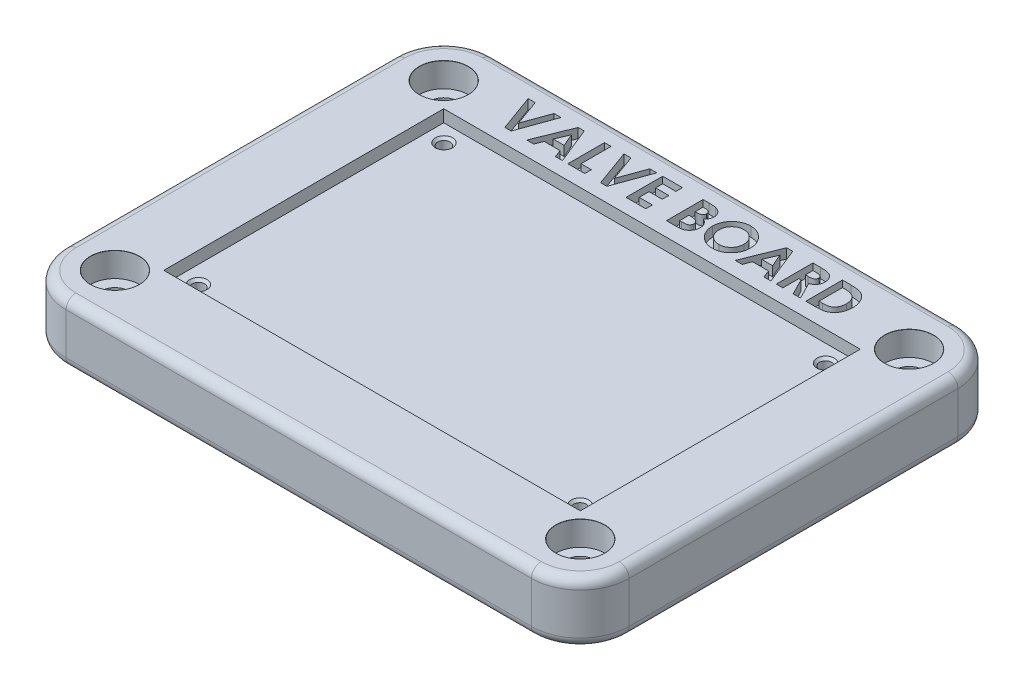
from build123d import *

# Parameters (mm, degrees)
SKETCH1_W           = 85.32
SKETCH1_H           = 57.35
SKETCH1_R           = 1.275
BOSS_EXTRUDE1_DEPTH = 10
SKETCH1_3_W         = 115.32
SKETCH1_3_H         = 87.35
SKETCH1_3_W_2       = 85.32
SKETCH1_3_H_2       = 57.35
BOSS_EXTRUDE2_DEPTH = 12.5
FILLET1_R           = 10
FILLET2_R           = 2
CUT_EXTRUDE1_DEPTH  = 2
CHAMFER1_SIZE       = 0.5


# Read off the part's stored shape, not the designer's step: CBORE for M5 SHCS1
with BuildPart() as part:
    # Sketch1 → Boss-Extrude1 (new body)
    with BuildSketch(Plane(origin=(0, 0, 0), x_dir=(1, 0, 0), z_dir=(0, 1, 0))):
        Rectangle(SKETCH1_W, SKETCH1_H)
        with Locations(Location((39.085, 25.15, 0), (0, 0, 270))):
            Circle(SKETCH1_R, mode=Mode.SUBTRACT)
        with Locations(Location((-39.085, 25.15, 0), (0, 0, 270))):
            Circle(SKETCH1_R, mode=Mode.SUBTRACT)
        with Locations(Location((-39.085, -25.15, 0), (0, 0, 270))):
            Circle(SKETCH1_R, mode=Mode.SUBTRACT)
        with Locations(Location((39.085, -25.15, 0), (0, 0, 270))):
            Circle(SKETCH1_R, mode=Mode.SUBTRACT)
    extrude(amount=BOSS_EXTRUDE1_DEPTH)

    # Sketch1<3> → Boss-Extrude2 (add)
    with BuildSketch(Plane(origin=(0, 0, 0), x_dir=(1, 0, 0), z_dir=(0, 1, 0))):
        Rectangle(SKETCH1_3_W, SKETCH1_3_H)
        Rectangle(SKETCH1_3_W_2, SKETCH1_3_H_2, mode=Mode.SUBTRACT)
    extrude(amount=BOSS_EXTRUDE2_DEPTH)

    # CBORE for M5 SHCS1 outline → CBORE for M5 SHCS1 (revolve, cut)
    with BuildSketch(Plane(origin=(47.66, 0, 33.675), x_dir=(1, 0, 0), z_dir=(0, 0, 1))):
        Polygon((0, 0), (2.75, 0), (2.75, 7.5), (5, 7.5), (5, 12.475), (5.025, 12.5), (0, 12.5), align=None)
    revolve(axis=Axis((47.66, 0, 33.675), (0, 1, 0)), mode=Mode.SUBTRACT)

    # CBORE for M5 SHCS1 2 outline → CBORE for M5 SHCS1 2 (revolve, cut)
    with BuildSketch(Plane(origin=(-47.66, 0, -33.675), x_dir=(1, 0, 0), z_dir=(0, 0, 1))):
        Polygon((0, 12.5), (0, 0), (2.75, 0), (2.75, 7.5), (5, 7.5), (5, 12.475), (5.025, 12.5), align=None)
    revolve(axis=Axis((-47.66, 0, -33.675), (0, 1, 0)), mode=Mode.SUBTRACT)

    # CBORE for M5 SHCS1 3 outline → CBORE for M5 SHCS1 3 (revolve, cut)
    with BuildSketch(Plane(origin=(-47.66, 0, 33.675), x_dir=(1, 0, 0), z_dir=(0, 0, 1))):
        Polygon((0, 12.5), (0, 0), (2.75, 0), (2.75, 7.5), (5, 7.5), (5, 12.475), (5.025, 12.5), align=None)
    revolve(axis=Axis((-47.66, 0, 33.675), (0, 1, 0)), mode=Mode.SUBTRACT)

    # CBORE for M5 SHCS1 4 outline → CBORE for M5 SHCS1 4 (revolve, cut)
    with BuildSketch(Plane(origin=(47.66, 0, -33.675), x_dir=(1, 0, 0), z_dir=(0, 0, 1))):
        Polygon((0, 12.5), (0, 0), (2.75, 0), (2.75, 7.5), (5, 7.5), (5, 12.475), (5.025, 12.5), align=None)
    revolve(axis=Axis((47.66, 0, -33.675), (0, 1, 0)), mode=Mode.SUBTRACT)

    # Fillet1
    fillet1_edges = [part.edges().sort_by_distance(p)[0] for p in [
        (-57.66, 6.25, 43.675),
        (57.66, 6.25, 43.675),
        (57.66, 6.25, -43.675),
        (-57.66, 6.25, -43.675),
    ]]
    fillet(fillet1_edges, radius=FILLET1_R)

    # Fillet2
    fillet2_edges = [part.edges().sort_by_distance(p)[0] for p in [
        (54.731067812, 0, 40.746067812),
        (0, 12.5, 43.675),
        (0, 12.5, -43.675),
        (-57.66, 12.5, 0),
        (-54.731067812, 12.5, 40.746067812),
        (-54.731067812, 12.5, -40.746067812),
        (54.731067812, 12.5, -40.746067812),
        (54.731067812, 12.5, 40.746067812),
        (57.66, 0, 0),
        (57.66, 12.5, 0),
        (0, 0, 43.675),
        (-57.66, 0, 0),
        (0, 0, -43.675),
        (-54.731067812, 0, 40.746067812),
        (-54.731067812, 0, -40.746067812),
        (54.731067812, 0, -40.746067812),
    ]]
    fillet(fillet2_edges, radius=FILLET2_R)

    # Sketch4 → Cut-Extrude1 (cut)
    # profile 1 of 10: a face of its own
    with BuildSketch(Plane(origin=(0, 12.5, 0), x_dir=(1, 0, 0), z_dir=(0, 1, 0))):
        Polygon((-35.80574543, 39.121172), (-34.367944949, 39.121172), (-32.440360814, 33.793647962), (-30.508269468, 39.121172), (-29.074976199, 39.121172), (-31.79432716, 31.621172), (-33.09090168, 31.621172), align=None)
    # profile 2 of 10: a face of its own
    with BuildSketch(Plane(origin=(0, 12.5, 0), x_dir=(1, 0, 0), z_dir=(0, 1, 0))):
        Polygon((-25.56385841, 39.121172), (-24.315360814, 39.121172), (-21.28651466, 31.621172), (-22.724315141, 31.621172), (-23.307247833, 33.159633538), (-26.574976199, 33.159633538), (-27.157908891, 31.621172), (-28.594206968, 31.621172), align=None)
        Polygon((-24.940360814, 37.10945325), (-26.064158891, 34.505787385), (-23.816562737, 34.505787385), align=None, mode=Mode.SUBTRACT)
    # profile 3 of 10: a face of its own
    with BuildSketch(Plane(origin=(0, 12.5, 0), x_dir=(1, 0, 0), z_dir=(0, 1, 0))):
        Polygon((-20.18074543, 39.121172), (-18.834591583, 39.121172), (-18.834591583, 32.967325846), (-16.719206968, 32.967325846), (-16.719206968, 31.621172), (-20.18074543, 31.621172), align=None)
    # profile 4 of 10: a face of its own
    with BuildSketch(Plane(origin=(0, 12.5, 0), x_dir=(1, 0, 0), z_dir=(0, 1, 0))):
        Polygon((-16.190360814, 39.121172), (-14.752560333, 39.121172), (-12.824976199, 33.793647962), (-10.892884853, 39.121172), (-9.459591583, 39.121172), (-12.178942545, 31.621172), (-13.475517064, 31.621172), align=None)
    # profile 5 of 10: a face of its own
    with BuildSketch(Plane(origin=(0, 12.5, 0), x_dir=(1, 0, 0), z_dir=(0, 1, 0))):
        Polygon((-8.257668506, 39.121172), (-4.219206968, 39.121172), (-4.219206968, 37.775018154), (-6.91151466, 37.775018154), (-6.91151466, 36.332710462), (-4.219206968, 36.332710462), (-4.219206968, 34.986556615), (-6.91151466, 34.986556615), (-6.91151466, 32.967325846), (-4.219206968, 32.967325846), (-4.219206968, 31.621172), (-8.257668506, 31.621172), align=None)
    # profile 6 of 10: a face of its own
    with BuildSketch(Plane(origin=(0, 12.5, 0), x_dir=(1, 0, 0), z_dir=(0, 1, 0))):
        with BuildLine():
            Line((0.011562263, 31.621172), (0.011562263, 39.121172))
            Line((0.011562263, 39.121172), (1.21348534, 39.121172))
            add(Edge.make_bspline(
                [(1.21348534, 39.121172), (1.29762747, 39.121181603), (1.460440898, 39.121200184), (1.695338184, 39.112951362), (1.913185578, 39.102280588), (2.113289807, 39.090342472), (2.295991462, 39.069770714), (2.461012715, 39.048090328), (2.608683278, 39.021945119), (2.699979964, 38.998492056), (2.742932455, 38.987458058)],
                knots=[0, 0, 0, 0, 1.311965854, 2.538629056, 3.664479157, 4.713267157, 5.663616078, 6.530575999, 7.308677837, 8, 8, 8, 8], degree=3))
            add(Edge.make_bspline(
                [(2.742932455, 38.987458058), (2.799333437, 38.971894406), (2.910010271, 38.941353526), (3.068534816, 38.879674899), (3.21891746, 38.811114732), (3.36097459, 38.732900404), (3.493833918, 38.644087649), (3.616990534, 38.543971622), (3.733100621, 38.436570977), (3.838041375, 38.318892488), (3.932890527, 38.194543365), (4.015297434, 38.063556192), (4.086898474, 37.927933848), (4.144198061, 37.785969615), (4.187372223, 37.638317278), (4.218949625, 37.485607336), (4.239416057, 37.327356575), (4.241349867, 37.21969341), (4.242331494, 37.165042192)],
                knots=[0, 0, 0, 0, 1.099996261, 2.158545794, 3.195537121, 4.207578794, 5.205712374, 6.197378256, 7.190519799, 8.17788031, 9.159561366, 10.129234751, 11.085776129, 12.040971148, 13.00380137, 13.975669004, 14.972423361, 16, 16, 16, 16], degree=3))
            add(Edge.make_bspline(
                [(4.242331494, 37.165042192), (4.239764831, 37.094829723), (4.234712672, 36.956625104), (4.202439134, 36.753627523), (4.141921223, 36.561765632), (4.062735008, 36.377503487), (3.955066513, 36.201528389), (3.818348347, 36.033924009), (3.654794897, 35.869529556), (3.529340372, 35.77098617), (3.464086301, 35.719729692)],
                knots=[0, 0, 0, 0, 0.986156485, 1.941127874, 2.875419072, 3.804401753, 4.751181392, 5.761612777, 6.835722519, 8, 8, 8, 8], degree=3))
            add(Edge.make_bspline(
                [(3.464086301, 35.719729692), (3.51696507, 35.69273554), (3.620645705, 35.639807474), (3.767841747, 35.552809535), (3.904129214, 35.460276194), (4.030119179, 35.364069257), (4.143168856, 35.260110374), (4.247946258, 35.154389799), (4.33928221, 35.040850182), (4.420957572, 34.923538291), (4.491948468, 34.800755436), (4.553773711, 34.672708971), (4.605995276, 34.53896146), (4.650217848, 34.40019357), (4.683199054, 34.255928005), (4.704703502, 34.106113168), (4.721168651, 33.951260006), (4.722449485, 33.845777899), (4.723100724, 33.792145558)],
                knots=[0, 0, 0, 0, 1.164658916, 2.283573913, 3.35186032, 4.395461096, 5.390182219, 6.362969632, 7.312859996, 8.245001507, 9.165155236, 10.092416118, 11.032087915, 11.979892451, 12.947605196, 13.931445124, 14.948243989, 16, 16, 16, 16], degree=3))
            add(Edge.make_bspline(
                [(4.723100724, 33.792145558), (4.718874615, 33.689710853), (4.710534405, 33.487556374), (4.649554861, 33.190747171), (4.543835706, 32.909345126), (4.401876682, 32.644468651), (4.226955852, 32.403785485), (4.025847058, 32.192949122), (3.800575006, 32.014480821), (3.592734309, 31.894028562), (3.412968475, 31.813193833), (3.264071793, 31.763216706), (3.104159913, 31.716917971), (2.930303632, 31.684406044), (2.745654729, 31.654647553), (2.548412865, 31.636274044), (2.338946681, 31.623822769), (2.195076251, 31.622073454), (2.120937263, 31.621172)],
                knots=[0, 0, 0, 0, 1.284142165, 2.534249414, 3.780121997, 5.041676246, 6.291546858, 7.49970053, 8.684500223, 9.883330709, 10.50184324, 11.153274765, 11.851151195, 12.587658647, 13.369265475, 14.195992086, 15.070362669, 16, 16, 16, 16], degree=3))
            Line((2.120937263, 31.621172), (0.011562263, 31.621172))
        make_face()
        with BuildLine():
            Line((1.357716109, 37.775018154), (1.357716109, 36.140402769))
            Line((1.357716109, 36.140402769), (1.715288224, 36.140402769))
            add(Edge.make_bspline(
                [(1.715288224, 36.140402769), (1.763885487, 36.140826556), (1.857699563, 36.14164465), (1.993204044, 36.15218142), (2.119201328, 36.170157803), (2.235213534, 36.19523938), (2.342321359, 36.227089326), (2.439840567, 36.265411671), (2.527342384, 36.312169096), (2.628999256, 36.381816344), (2.736457902, 36.484305389), (2.831052538, 36.632372048), (2.886768148, 36.802648143), (2.892973364, 36.92274003), (2.896177647, 36.984753731)],
                knots=[0, 0, 0, 0, 1.065314748, 2.056525647, 2.977365736, 3.853934255, 4.656397591, 5.425096493, 6.14721249, 6.826394842, 8.123232004, 9.372140726, 10.643011755, 12, 12, 12, 12], degree=3))
            add(Edge.make_bspline(
                [(2.896177647, 36.984753731), (2.893613634, 37.042839865), (2.888656218, 37.155147071), (2.832557762, 37.312836391), (2.745425771, 37.452581401), (2.642554208, 37.548225433), (2.545680642, 37.613547486), (2.46273155, 37.656559277), (2.371688693, 37.695062992), (2.270789579, 37.724503871), (2.160610397, 37.74659527), (2.041686348, 37.762818757), (1.913812248, 37.773861153), (1.825489336, 37.774624214), (1.77989159, 37.775018154)],
                knots=[0, 0, 0, 0, 1.347982417, 2.606269829, 3.849316587, 5.153353503, 5.842674298, 6.568177932, 7.326619318, 8.142485038, 9.012069166, 9.942760135, 10.937925643, 12, 12, 12, 12], degree=3))
            Line((1.77989159, 37.775018154), (1.357716109, 37.775018154))
        make_face(mode=Mode.SUBTRACT)
        with BuildLine():
            Line((1.357716109, 34.890402769), (1.357716109, 32.967325846))
            Line((1.357716109, 32.967325846), (1.745336301, 32.967325846))
            add(Edge.make_bspline(
                [(1.745336301, 32.967325846), (1.821969307, 32.967763648), (1.969305823, 32.968605376), (2.18036512, 32.978775452), (2.372270787, 32.997105223), (2.544514345, 33.019988465), (2.697359617, 33.050991679), (2.830289951, 33.090408292), (2.945128312, 33.133773433), (3.041186126, 33.18733453), (3.119659857, 33.249666364), (3.190474172, 33.313370996), (3.248211751, 33.386860308), (3.293894802, 33.466979607), (3.333433401, 33.551738672), (3.357280292, 33.644447314), (3.375436478, 33.742357871), (3.376435662, 33.810080486), (3.376946878, 33.844729692)],
                knots=[0, 0, 0, 0, 1.753078804, 3.370512758, 4.83203934, 6.162291463, 7.344201807, 8.395507345, 9.331626367, 10.147333109, 10.898971645, 11.62040215, 12.321813352, 13.025280112, 13.727906689, 14.453419512, 15.208716525, 16, 16, 16, 16], degree=3))
            add(Edge.make_bspline(
                [(3.376946878, 33.844729692), (3.375819499, 33.884351604), (3.373623668, 33.96152443), (3.355690289, 34.074320752), (3.323099482, 34.179623602), (3.282049771, 34.280125716), (3.224926916, 34.37222877), (3.157038355, 34.459120099), (3.075011642, 34.537857297), (2.982767819, 34.613202681), (2.875174532, 34.679171648), (2.752181301, 34.736411411), (2.61311996, 34.784215954), (2.457559752, 34.822277962), (2.286182641, 34.854580662), (2.097737763, 34.87386894), (1.893794551, 34.88821448), (1.752377009, 34.889656765), (1.679230532, 34.890402769)],
                knots=[0, 0, 0, 0, 0.845221588, 1.646264278, 2.427170338, 3.19324141, 3.95557735, 4.731569926, 5.540061037, 6.376114724, 7.268642756, 8.224665384, 9.265483498, 10.400594375, 11.639216012, 12.983232105, 14.439614077, 16, 16, 16, 16], degree=3))
            Line((1.679230532, 34.890402769), (1.357716109, 34.890402769))
        make_face(mode=Mode.SUBTRACT)
    # profile 7 of 10: a face of its own
    with BuildSketch(Plane(origin=(0, 12.5, 0), x_dir=(1, 0, 0), z_dir=(0, 1, 0))):
        with BuildLine():
            add(Edge.make_bspline(
                [(9.593893994, 39.313479692), (9.724290685, 39.310103488), (9.981723289, 39.303438097), (10.360313751, 39.24787686), (10.725155663, 39.15734779), (11.076084043, 39.031505834), (11.412220208, 38.866942554), (11.734749822, 38.668323425), (12.0425176, 38.431899631), (12.332369783, 38.163186549), (12.600245477, 37.870972806), (12.832359922, 37.55635276), (13.030298605, 37.227478533), (13.194350715, 36.883468896), (13.319306932, 36.521941418), (13.406993879, 36.144739413), (13.463328397, 35.75197019), (13.469807733, 35.484547885), (13.473100724, 35.348635942)],
                knots=[0, 0, 0, 0, 1.014329547, 2.002516266, 2.970391464, 3.935626869, 4.897733899, 5.877609409, 6.878433252, 7.912639331, 8.949961323, 9.958554974, 10.949718813, 11.932905612, 12.9188844, 13.919928257, 14.942845884, 16, 16, 16, 16], degree=3))
            add(Edge.make_bspline(
                [(13.473100724, 35.348635942), (13.469593832, 35.214255413), (13.462683387, 34.94945427), (13.4092937, 34.56030457), (13.320130095, 34.187143184), (13.197293233, 33.829125453), (13.036216408, 33.487985491), (12.842137745, 33.161545168), (12.609935876, 32.852833928), (12.348080116, 32.562017436), (12.05979965, 32.298039068), (11.754464871, 32.065408586), (11.433485629, 31.868286295), (11.097331734, 31.706762486), (10.74528232, 31.581409806), (10.378206992, 31.492964382), (9.996128465, 31.439214312), (9.736296538, 31.432349006), (9.60441082, 31.428864308)],
                knots=[0, 0, 0, 0, 1.051557043, 2.072126891, 3.067553643, 4.050577992, 5.02905126, 6.015227836, 7.017913613, 8.04756643, 9.074058332, 10.072836633, 11.047628519, 12.017157415, 12.98668631, 13.966869689, 14.968021931, 16, 16, 16, 16], degree=3))
            add(Edge.make_bspline(
                [(9.60441082, 31.428864308), (9.466474173, 31.431990254), (9.195447516, 31.43813231), (8.79879879, 31.496540466), (8.418775038, 31.584523552), (8.058568676, 31.715833588), (7.714511312, 31.879982174), (7.389130837, 32.082141), (7.082536599, 32.321975981), (6.796487272, 32.593344855), (6.53732589, 32.890281924), (6.308565135, 33.203969605), (6.115600364, 33.532011601), (5.958424516, 33.874561441), (5.834513392, 34.229490262), (5.747108172, 34.598959683), (5.695475823, 34.982083583), (5.688283737, 35.242308994), (5.684639186, 35.374176808)],
                knots=[0, 0, 0, 0, 1.067978421, 2.098431617, 3.099715153, 4.085208694, 5.062210972, 6.048429807, 7.046490867, 8.072918869, 9.098532598, 10.095778865, 11.076610158, 12.041847152, 13.011192615, 13.984257998, 14.978533688, 16, 16, 16, 16], degree=3))
            add(Edge.make_bspline(
                [(5.684639186, 35.374176808), (5.685783056, 35.462890569), (5.688056312, 35.639194773), (5.715440074, 35.900468604), (5.754864819, 36.15664272), (5.813172145, 36.406695752), (5.884000644, 36.652391708), (5.97576897, 36.891443588), (6.08022616, 37.126405125), (6.202274551, 37.354501128), (6.337980561, 37.573632923), (6.4860479, 37.782766828), (6.646848881, 37.979374107), (6.819865512, 38.164746784), (7.00569403, 38.337666389), (7.201890054, 38.500580841), (7.412258645, 38.649162553), (7.632195493, 38.787040186), (7.860460646, 38.911720538), (8.096124858, 39.017844725), (8.334332979, 39.11052117), (8.578267149, 39.183665518), (8.82531318, 39.243240825), (9.078110258, 39.282638997), (9.334374505, 39.310022001), (9.5071822, 39.312324393), (9.593893994, 39.313479692)],
                knots=[0, 0, 0, 0, 1.034744296, 2.056386356, 3.06226378, 4.057406941, 5.050368692, 6.043467995, 7.042652155, 8.049140477, 9.059438543, 10.048523776, 11.036952808, 12.020949711, 13.004946614, 13.997082645, 14.994316842, 16.007702937, 17.024872941, 18.026463647, 19.021641123, 20.005082605, 20.995858141, 21.984425357, 22.988620895, 24, 24, 24, 24], degree=3))
        make_face()
        with BuildLine():
            add(Edge.make_bspline(
                [(9.57286034, 37.967325846), (9.485103383, 37.96497113), (9.311906269, 37.960323862), (9.057857644, 37.92491797), (8.813961992, 37.868370735), (8.581571323, 37.786462757), (8.359678437, 37.682214689), (8.147889985, 37.555990786), (7.9491388, 37.403452244), (7.760774726, 37.232788176), (7.590618782, 37.042629183), (7.440280637, 36.838841482), (7.314471824, 36.621765396), (7.209106156, 36.393417509), (7.129789159, 36.15123011), (7.073294041, 35.89710028), (7.037591235, 35.630590139), (7.033090852, 35.448910523), (7.030793032, 35.356147962)],
                knots=[0, 0, 0, 0, 1.033739768, 2.040188636, 3.016340934, 3.979330865, 4.937572243, 5.900995986, 6.878200029, 7.884839167, 8.891893314, 9.879764717, 10.863503415, 11.843163062, 12.837761627, 13.859916423, 14.907309254, 16, 16, 16, 16], degree=3))
            add(Edge.make_bspline(
                [(7.030793032, 35.356147962), (7.033839591, 35.253346176), (7.03981034, 35.051871711), (7.081821263, 34.757966189), (7.153697771, 34.480401594), (7.25748605, 34.220535452), (7.386210745, 33.975482145), (7.546066386, 33.748245149), (7.734464069, 33.537463876), (7.879604118, 33.414400989), (7.953268994, 33.351941231)],
                knots=[0, 0, 0, 0, 1.078454662, 2.113592447, 3.107694534, 4.079536787, 5.043276885, 6.005368276, 6.987637804, 8, 8, 8, 8], degree=3))
            add(Edge.make_bspline(
                [(7.953268994, 33.351941231), (8.01361459, 33.30579836), (8.132946187, 33.214552227), (8.323425397, 33.097601588), (8.519581476, 32.997363223), (8.722894667, 32.916371811), (8.932935584, 32.852665327), (9.149675424, 32.808052724), (9.372807085, 32.780054458), (9.523699171, 32.776708134), (9.599903609, 32.775018154)],
                knots=[0, 0, 0, 0, 1.023928204, 2.024787132, 3.009472467, 3.9914905, 4.972207045, 5.96565515, 6.972602802, 8, 8, 8, 8], degree=3))
            add(Edge.make_bspline(
                [(9.599903609, 32.775018154), (9.686151582, 32.777392835), (9.855847182, 32.782065096), (10.105166555, 32.817035123), (10.344022086, 32.876217033), (10.573896612, 32.957406486), (10.794127276, 33.062963479), (11.003637752, 33.193102451), (11.202795368, 33.346225463), (11.390919468, 33.519130724), (11.562873788, 33.710038812), (11.712898209, 33.914913495), (11.842707113, 34.129240771), (11.945881701, 34.356054118), (12.028332333, 34.593212524), (12.084147503, 34.841766312), (12.120151916, 35.100690849), (12.124653567, 35.276898147), (12.126946878, 35.366664788)],
                knots=[0, 0, 0, 0, 1.026359118, 2.019393844, 2.989460624, 3.950973911, 4.916101784, 5.890408035, 6.881132271, 7.902007068, 8.92769091, 9.933912415, 10.920395702, 11.90457117, 12.894218921, 13.903490204, 14.931958862, 16, 16, 16, 16], degree=3))
            add(Edge.make_bspline(
                [(12.126946878, 35.366664788), (12.124574218, 35.455915247), (12.119904, 35.631591163), (12.084872424, 35.889850007), (12.02606583, 36.137306503), (11.944632574, 36.374364773), (11.840646618, 36.601257223), (11.712057435, 36.817185964), (11.559316227, 37.021942247), (11.385938325, 37.214130736), (11.197227134, 37.390739646), (10.994626816, 37.544004076), (10.783806353, 37.677185992), (10.559928496, 37.781515328), (10.327573599, 37.864634288), (10.085323819, 37.925844283), (9.832261621, 37.960075134), (9.660098175, 37.964887399), (9.57286034, 37.967325846)],
                knots=[0, 0, 0, 0, 1.055025985, 2.07665775, 3.074803781, 4.057872707, 5.035505728, 6.020516407, 7.023567878, 8.050795229, 9.077271434, 10.074415901, 11.050397877, 12.019801805, 12.988065821, 13.964604439, 14.968634123, 16, 16, 16, 16], degree=3))
        make_face(mode=Mode.SUBTRACT)
    # profile 8 of 10: a face of its own
    with BuildSketch(Plane(origin=(0, 12.5, 0), x_dir=(1, 0, 0), z_dir=(0, 1, 0))):
        Polygon((17.128449282, 39.121172), (18.376946878, 39.121172), (21.405793032, 31.621172), (19.967992551, 31.621172), (19.385059859, 33.159633538), (16.117331494, 33.159633538), (15.534398801, 31.621172), (14.098100724, 31.621172), align=None)
        Polygon((17.751946878, 37.10945325), (16.628148801, 34.505787385), (18.875744955, 34.505787385), align=None, mode=Mode.SUBTRACT)
    # profile 9 of 10: a face of its own
    with BuildSketch(Plane(origin=(0, 12.5, 0), x_dir=(1, 0, 0), z_dir=(0, 1, 0))):
        with BuildLine():
            Line((22.511562263, 39.121172), (24.080071878, 39.121172))
            add(Edge.make_bspline(
                [(24.080071878, 39.121172), (24.183749886, 39.120804003), (24.3831519, 39.12009624), (24.670678714, 39.108929619), (24.934811633, 39.09339035), (25.175941731, 39.069677012), (25.393965849, 39.038235993), (25.589102497, 39.001172234), (25.761345972, 38.958930135), (25.912148909, 38.906293146), (26.048241103, 38.846919421), (26.175097949, 38.778697922), (26.295518096, 38.702388318), (26.408696666, 38.615982695), (26.515617208, 38.52103547), (26.616481434, 38.417451069), (26.709864038, 38.30435114), (26.795186793, 38.182450329), (26.872951615, 38.054213472), (26.941679408, 37.919464498), (26.997568964, 37.778109698), (27.046953377, 37.632191954), (27.08252337, 37.479625345), (27.10726178, 37.321895131), (27.125374276, 37.158446086), (27.126415658, 37.047406061), (27.126946878, 36.990763346)],
                knots=[0, 0, 0, 0, 1.749336639, 3.364467119, 4.854658419, 6.213483162, 7.451590619, 8.570285859, 9.5643256, 10.440900261, 11.26203566, 12.067320669, 12.869050712, 13.665104639, 14.467235401, 15.27997916, 16.102287765, 16.939272006, 17.78853747, 18.631303466, 19.488103222, 20.351255419, 21.228522269, 22.127379805, 23.044756219, 24, 24, 24, 24], degree=3))
            add(Edge.make_bspline(
                [(27.126946878, 36.990763346), (27.125566959, 36.931641363), (27.12286119, 36.815713931), (27.108286443, 36.645425987), (27.081648384, 36.482506394), (27.041301168, 36.32743216), (26.994927285, 36.178273205), (26.933261915, 36.037781605), (26.863666451, 35.903914113), (26.781009951, 35.778564336), (26.690298481, 35.658948005), (26.584802949, 35.549648066), (26.471357845, 35.444790059), (26.343586008, 35.350941936), (26.207119738, 35.261758024), (26.059247595, 35.18093365), (25.900934641, 35.106437074), (25.789632795, 35.064892637), (25.732716109, 35.043647962)],
                knots=[0, 0, 0, 0, 1.099860209, 2.156625411, 3.176576793, 4.16617041, 5.135385252, 6.078461593, 7.016046972, 7.938469504, 8.868247731, 9.803980173, 10.76021508, 11.73834243, 12.748633912, 13.790971185, 14.870363756, 16, 16, 16, 16], degree=3))
            Line((25.732716109, 35.043647962), (27.46348534, 31.621172))
            Line((27.46348534, 31.621172), (25.967091109, 31.621172))
            Line((25.967091109, 31.621172), (24.314446878, 34.890402769))
            Line((24.314446878, 34.890402769), (23.857716109, 34.890402769))
            Line((23.857716109, 34.890402769), (23.857716109, 31.621172))
            Line((23.857716109, 31.621172), (22.511562263, 31.621172))
            Line((22.511562263, 31.621172), (22.511562263, 39.121172))
        make_face()
        with BuildLine():
            Line((23.857716109, 36.236556615), (24.382055051, 36.236556615))
            add(Edge.make_bspline(
                [(24.382055051, 36.236556615), (24.446159845, 36.237278607), (24.568906752, 36.238661065), (24.745432926, 36.245073479), (24.90576079, 36.260524228), (25.050578848, 36.280045672), (25.180615811, 36.302585998), (25.294711794, 36.334887654), (25.394624843, 36.369499697), (25.479170984, 36.412513487), (25.551405265, 36.461429495), (25.613774943, 36.516999297), (25.665363609, 36.581314267), (25.707823713, 36.652626601), (25.740853057, 36.73156704), (25.764961948, 36.817268996), (25.778435253, 36.910708725), (25.779985403, 36.975194861), (25.780793032, 37.008792192)],
                knots=[0, 0, 0, 0, 1.688639943, 3.233382647, 4.650958383, 5.928841754, 7.082724185, 8.122798841, 9.049171256, 9.863274652, 10.613301712, 11.341792392, 12.054588806, 12.776240173, 13.521029143, 14.301969904, 15.115324896, 16, 16, 16, 16], degree=3))
            add(Edge.make_bspline(
                [(25.780793032, 37.008792192), (25.779266135, 37.048540288), (25.776266828, 37.126618055), (25.746504391, 37.239022663), (25.69912902, 37.343060818), (25.634190361, 37.43826245), (25.552408563, 37.521722772), (25.458557498, 37.595293712), (25.350611633, 37.653468105), (25.250661884, 37.691839316), (25.159730976, 37.714797207), (25.0776687, 37.731905225), (24.98264009, 37.744030168), (24.874573405, 37.756890828), (24.753744111, 37.765230315), (24.619493615, 37.771316479), (24.472207484, 37.773806627), (24.369535063, 37.774602684), (24.315949282, 37.775018154)],
                knots=[0, 0, 0, 0, 1.020303359, 2.004196876, 2.966617323, 3.9489082, 4.950758222, 5.960522915, 7.003732012, 8.091992268, 8.70421221, 9.413913587, 10.24622431, 11.166358409, 12.212345909, 13.359657661, 14.621978493, 16, 16, 16, 16], degree=3))
            Line((24.315949282, 37.775018154), (23.857716109, 37.775018154))
            Line((23.857716109, 37.775018154), (23.857716109, 36.236556615))
        make_face(mode=Mode.SUBTRACT)
    # profile 10 of 10: a face of its own
    with BuildSketch(Plane(origin=(0, 12.5, 0), x_dir=(1, 0, 0), z_dir=(0, 1, 0))):
        with BuildLine():
            Line((28.56925457, 39.121172), (30.265468513, 39.121172))
            add(Edge.make_bspline(
                [(30.265468513, 39.121172), (30.397707899, 39.120247601), (30.653328129, 39.118460729), (31.023671272, 39.098326968), (31.368043267, 39.067362674), (31.686666104, 39.024765676), (31.978886556, 38.968398183), (32.244327808, 38.897696211), (32.483880746, 38.816082546), (32.700172019, 38.720047508), (32.897625147, 38.608080192), (33.085113194, 38.48335759), (33.262268032, 38.34131075), (33.431575747, 38.184680039), (33.590851389, 38.010599945), (33.742747468, 37.821953865), (33.883544877, 37.616006172), (34.01749962, 37.397694841), (34.138643859, 37.166094691), (34.244310391, 36.923177052), (34.332827886, 36.67050519), (34.404752935, 36.407809824), (34.462085499, 36.135963022), (34.502199939, 35.854416222), (34.526999085, 35.56343009), (34.529514752, 35.3662145), (34.530793032, 35.266003731)],
                knots=[0, 0, 0, 0, 1.44355588, 2.790409838, 4.047694926, 5.217575253, 6.298404546, 7.294384826, 8.214239204, 9.058592145, 9.873746385, 10.689560431, 11.514393297, 12.350027578, 13.205127629, 14.088021785, 14.991911688, 15.926770944, 16.882954281, 17.842803888, 18.816321264, 19.80318086, 20.814351908, 21.847355356, 22.906180909, 24, 24, 24, 24], degree=3))
            add(Edge.make_bspline(
                [(34.530793032, 35.266003731), (34.527445804, 35.124599812), (34.520856589, 34.84623792), (34.465352724, 34.437745051), (34.375584181, 34.046163894), (34.249361456, 33.674557548), (34.092879067, 33.326235223), (33.90594333, 33.007339436), (33.691295159, 32.719581859), (33.451435217, 32.464395289), (33.191725318, 32.245058973), (32.921834362, 32.057213469), (32.639133119, 31.909081616), (32.390033816, 31.815143869), (32.174033643, 31.756722717), (31.984387828, 31.722195254), (31.768969533, 31.690531488), (31.525770168, 31.666062411), (31.255856597, 31.644242007), (30.958152941, 31.632385649), (30.633623079, 31.622534775), (30.408206405, 31.621638161), (30.291009378, 31.621172)],
                knots=[0, 0, 0, 0, 1.315458931, 2.589557908, 3.828601765, 5.048913369, 6.235739168, 7.376350998, 8.481830359, 9.569842114, 10.627874879, 11.640079404, 12.624025415, 13.590060155, 14.111227486, 14.704434459, 15.382649715, 16.137166398, 16.978595427, 17.902333227, 18.909396075, 20, 20, 20, 20], degree=3))
            Line((30.291009378, 31.621172), (28.56925457, 31.621172))
            Line((28.56925457, 31.621172), (28.56925457, 39.121172))
        make_face()
        with BuildLine():
            Line((29.915408417, 37.775018154), (29.915408417, 32.967325846))
            Line((29.915408417, 32.967325846), (30.618533417, 32.967325846))
            add(Edge.make_bspline(
                [(30.618533417, 32.967325846), (30.702194493, 32.967479148), (30.863102595, 32.967773998), (31.09541747, 32.98181797), (31.310249824, 32.995914246), (31.507008274, 33.022669448), (31.687124767, 33.052472861), (31.848124974, 33.09394839), (31.993327808, 33.13751492), (32.120959646, 33.192980513), (32.23786001, 33.255410729), (32.346096394, 33.328554964), (32.450574809, 33.40977888), (32.549341945, 33.501471385), (32.642771614, 33.6024183), (32.730311026, 33.713139759), (32.8131286, 33.833297947), (32.889098566, 33.963528171), (32.958520328, 34.10245517), (33.02010521, 34.248733234), (33.071168165, 34.403580543), (33.113608566, 34.565547542), (33.143937045, 34.736044335), (33.169028077, 34.913808078), (33.181963236, 35.099543055), (33.183738505, 35.225923341), (33.184639186, 35.290042192)],
                knots=[0, 0, 0, 0, 1.50275155, 2.890291501, 4.180787663, 5.369391935, 6.45668281, 7.458360028, 8.354766181, 9.177074746, 9.954075863, 10.732690366, 11.5210699, 12.329727389, 13.151100085, 13.990027547, 14.863562427, 15.770965086, 16.696477834, 17.652329173, 18.619756807, 19.62365428, 20.657822005, 21.729286259, 22.847956731, 24, 24, 24, 24], degree=3))
            add(Edge.make_bspline(
                [(33.184639186, 35.290042192), (33.182845336, 35.388298271), (33.179347468, 35.579890011), (33.145614784, 35.858947563), (33.09070441, 36.121722053), (33.012352596, 36.367238254), (32.913587707, 36.596186196), (32.789960425, 36.806626205), (32.646791192, 37.002093382), (32.53357687, 37.116760701), (32.477006974, 37.174056615)],
                knots=[0, 0, 0, 0, 1.13821349, 2.219428113, 3.251817212, 4.244760574, 5.201143372, 6.134805572, 7.068016741, 8, 8, 8, 8], degree=3))
            add(Edge.make_bspline(
                [(32.477006974, 37.174056615), (32.421223701, 37.22288048), (32.307292682, 37.322597696), (32.107267252, 37.442084422), (31.886849588, 37.547065222), (31.640997194, 37.630303289), (31.372086125, 37.696131501), (31.078514741, 37.741531609), (30.76185518, 37.770705237), (30.542480814, 37.773549715), (30.429230532, 37.775018154)],
                knots=[0, 0, 0, 0, 0.813307809, 1.661089106, 2.549956539, 3.493439533, 4.508053171, 5.589449661, 6.755572447, 8, 8, 8, 8], degree=3))
            Line((30.429230532, 37.775018154), (29.915408417, 37.775018154))
        make_face(mode=Mode.SUBTRACT)
    extrude(amount=-CUT_EXTRUDE1_DEPTH, mode=Mode.SUBTRACT)

    # Chamfer1
    chamfer1_edges = [part.edges().sort_by_distance(p)[0] for p in [
        (-39.085, 10, -26.425),
        (39.085, 10, -26.425),
        (-39.085, 10, 23.875),
        (39.085, 10, 23.875),
    ]]
    chamfer(chamfer1_edges, length=CHAMFER1_SIZE)


solid = part.part
